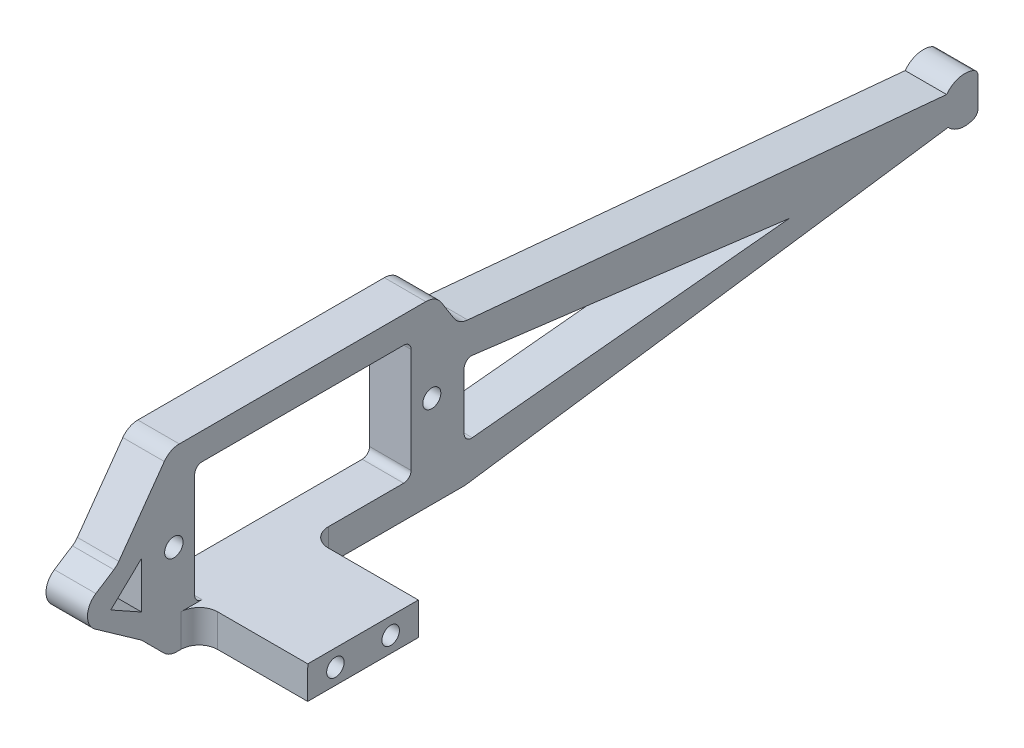
from build123d import *

# Parameters (mm, degrees)
SKETCH_1_R      = 0.978970723
SKETCH_1_R_2    = 1.00064107
EXTRUDE_1_DEPTH = 4.5
SKETCH_2_R      = 0.95
EXTRUDE_2_DEPTH = 11.76992
FILLET_1_R      = 2
FILLET_2_R      = 0.8


with BuildPart() as part:
    # 草图1 → 凸台-拉伸1 (new body)
    with BuildSketch(Plane(origin=(0, 0, 0), x_dir=(0, 0, -1), z_dir=(1, 0, 0))):
        with BuildLine():
            Line((-39.321623093, -59.770803947), (-31.880209784, -65.026985305))
            Line((-31.880209784, -65.026985305), (-28.883499317, -68.026462319))
            Line((-28.883499317, -68.026462319), (3.215977086, -68.026462319))
            Line((3.215977086, -68.026462319), (55.639850151, -60.599346768))
            ThreePointArc((55.639850151, -60.599346768), (57.197718569, -61.373971566), (58.88034135, -60.931503307))
            Line((58.88034135, -60.931503307), (58.88034135, -56.894014776))
            ThreePointArc((58.88034135, -56.894014776), (57.069785986, -56.468040051), (55.474117274, -57.423763105))
            Line((55.474117274, -57.423763105), (2.519577321, -52.531922747))
            Line((2.519577321, -52.531922747), (0.064241127, -48.627089366))
            Line((0.064241127, -48.627089366), (-28.81990203, -48.627089366))
            Line((-28.81990203, -48.627089366), (-34.57208033, -56.689800145))
            Line((-34.57208033, -56.689800145), (-39.321623093, -59.770803947))
        make_face()
        with Locations((-0.389382662, -58.037544978)):
            Circle(SKETCH_1_R, mode=Mode.SUBTRACT)
        with Locations((-28.381009123, -58.037544978)):
            Circle(SKETCH_1_R_2, mode=Mode.SUBTRACT)
        Polygon((-26.120321367, -51.538768317), (-26.120321367, -64.493439573), (-2.641506603, -64.493439573), (-2.630422679, -51.527089366), align=None, mode=Mode.SUBTRACT)
        Polygon((3.119577321, -56.086889198), (3.119577321, -64.024429188), (38.403692816, -60.533510862), align=None, mode=Mode.SUBTRACT)
        Polygon((-31.880209784, -57.326749532), (-31.880422679, -62.379599563), (-35.223651542, -60.515120464), align=None, mode=Mode.SUBTRACT)
    extrude(amount=EXTRUDE_1_DEPTH)

    # 草图2 → 凸台-拉伸2 (add)
    with BuildSketch(Plane(origin=(4.5, 0, 0), x_dir=(0, 0, -1), z_dir=(1, 0, 0))):
        Polygon((-25.62686112, -68.026462319), (-25.620633929, -64.493439573), (-13.620633929, -64.493439573), (-13.620633929, -68.026462319), align=None)
        with Locations((-22.620633929, -66.317445767)):
            Circle(SKETCH_2_R, mode=Mode.SUBTRACT)
        with Locations((-16.620633929, -66.317445767)):
            Circle(SKETCH_2_R, mode=Mode.SUBTRACT)
    extrude(amount=EXTRUDE_2_DEPTH)

    # 圆角1
    # the kernel refuses this fillet: 2 mm, written as the material it adds along each edge
    with BuildSketch(Plane(origin=(0, -56.689800145, 34.57208033), x_dir=(0, -0.5442183706519984, 0.8389436006340856), z_dir=(1, 0, 0))) as fillet_1_piece_1:
        with BuildLine():
            CenterArc((FILLET_1_R * 0.19006878131, -FILLET_1_R), FILLET_1_R, 90, 21.523541221)
            Line((-FILLET_1_R * 0.176814696818, -FILLET_1_R * 0.0697330955707), (0, 0))
            Line((0, 0), (FILLET_1_R * 0.19006878131, 0))
        make_face()
    extrude(amount=4.5)
    with BuildSketch(Plane(origin=(0, -52.531922747, -2.519577321), x_dir=(0, -0.09198645148038477, -0.9957602586687455), z_dir=(1, 0, 0))) as fillet_1_piece_2:
        with BuildLine():
            CenterArc((FILLET_1_R * 0.493803738743, FILLET_1_R), FILLET_1_R, 217.439335715, 52.560664285)
            Line((-FILLET_1_R * 0.30019370817, FILLET_1_R * 0.392078907838), (0, 0))
            Line((0, 0), (FILLET_1_R * 0.493803738743, 0))
        make_face()
    extrude(amount=4.5)
    with BuildSketch(Plane(origin=(4.5, -64.493439573, 13.620633929), x_dir=(0, 0, -1), z_dir=(0, -1, 0))) as fillet_1_piece_3:
        with BuildLine():
            CenterArc((FILLET_1_R, FILLET_1_R), FILLET_1_R, 180, 90)
            Line((0, FILLET_1_R), (0, 0))
            Line((0, 0), (FILLET_1_R, 0))
        make_face()
    extrude(amount=3.533022746)
    with BuildSketch(Plane(origin=(4.5, -73.026454553, 25.635673944), x_dir=(0, 0.0017625646835904966, 0.9999984466816618), z_dir=(0, 0.9999984466816617, -0.0017625646835904966))) as fillet_1_piece_4_section:
        with BuildLine():
            CenterArc((FILLET_1_R, FILLET_1_R), FILLET_1_R, 180, 90)
            Line((0, FILLET_1_R), (0, 0))
            Line((0, 0), (FILLET_1_R, 0))
        make_face()
    fillet_1_piece_4 = extrude(amount=13.533028234, mode=Mode.PRIVATE)
    fillet_1_piece_4 = split(fillet_1_piece_4, bisect_by=Plane(origin=(4.696560989, -68.026462319, 26.482181103), z_dir=(0, 1, 0)), keep=Keep.TOP, mode=Mode.PRIVATE)
    fillet_1_piece_4 = split(fillet_1_piece_4, bisect_by=Plane(origin=(4.696560989, -64.493439573, 26.482181103), z_dir=(0, -1, 0)), keep=Keep.TOP, mode=Mode.PRIVATE)
    add(fillet_1_piece_4)
    # the kernel refuses this fillet: 2 mm, written as the material it takes off along each edge
    with BuildSketch(Plane(origin=(-2.574882543, -48.627089366, 28.81990203), x_dir=(0, 0, -1), z_dir=(1, 0, 0))) as fillet_1_2_piece_1:
        with BuildLine():
            CenterArc((FILLET_1_R * 0.514976508546, -FILLET_1_R), FILLET_1_R, 90, 54.49480721)
            Line((-FILLET_1_R * 0.299086376608, -FILLET_1_R * 0.419223262333), (0, 0))
            Line((0, 0), (FILLET_1_R * 0.514976508546, 0))
        make_face()
    extrude(amount=9.649765085, mode=Mode.SUBTRACT)
    with BuildSketch(Plane(origin=(-2.762343959, -48.627089366, -0.064241127), x_dir=(0, -0.8465516071687306, -0.532306656355187), z_dir=(1, 0, 0))) as fillet_1_2_piece_2:
        with BuildLine():
            CenterArc((FILLET_1_R * 0.552468791842, -FILLET_1_R), FILLET_1_R, 90, 57.83856081)
            Line((-FILLET_1_R * 0.294082815326, -FILLET_1_R * 0.467693343645), (0, 0))
            Line((0, 0), (FILLET_1_R * 0.552468791842, 0))
        make_face()
    extrude(amount=10.024687918, mode=Mode.SUBTRACT)
    with BuildSketch(Plane(origin=(-2.072419305, -68.026462319, 28.883499317), x_dir=(0, 0.7074329539484039, 0.70678045789894), z_dir=(1, 0, 0))) as fillet_1_2_piece_3:
        with BuildLine():
            CenterArc((FILLET_1_R * 0.414483860929, -FILLET_1_R), FILLET_1_R, 90, 45.026435379)
            Line((-FILLET_1_R * 0.292949093019, -FILLET_1_R * 0.293219542101), (0, 0))
            Line((0, 0), (FILLET_1_R * 0.414483860929, 0))
        make_face()
    extrude(amount=8.644838609, mode=Mode.SUBTRACT)
    with BuildSketch(Plane(origin=(-7.384077235, -59.770803947, 39.321623093), x_dir=(0, -0.5769336472143782, -0.816791017771324), z_dir=(1, 0, 0))) as fillet_1_2_piece_4:
        with BuildLine():
            CenterArc((FILLET_1_R * 1.47681544699, FILLET_1_R), FILLET_1_R, 158.206425449, 111.793574551)
            Line((FILLET_1_R * 0.548287978811, FILLET_1_R * 1.37126370795), (0, 0))
            Line((0, 0), (FILLET_1_R * 1.47681544699, 0))
        make_face()
    extrude(amount=19.26815447, mode=Mode.SUBTRACT)

    # 圆角2
    fillet_2_edges = [part.edges().sort_by_distance(p)[0] for p in [
        (2.25, -56.894014776, -58.88034135),
        (2.25, -60.931503307, -58.88034135),
        (2.25, -51.527089366, 2.630422679),
        (2.25, -51.538768317, 26.120321367),
        (2.25, -64.493439573, 26.120321367),
        (2.25, -64.493439573, 2.641506603),
        (2.25, -56.086889198, -3.119577321),
        (2.25, -64.024429188, -3.119577321),
    ]]
    fillet(fillet_2_edges, radius=FILLET_2_R)


solid = part.part
